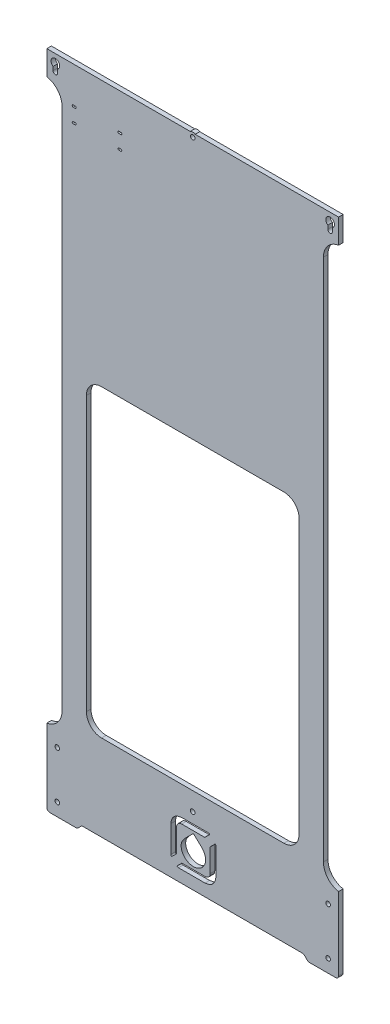
from build123d import *

# Parameters (mm, degrees)
SKETCH1_R           = 1.5
BOSS_EXTRUDE1_DEPTH = 3
SKETCH2_W           = 10
SKETCH2_H           = 368
CUT_EXTRUDE1_DEPTH  = 407.004798494
FILLET1_R           = 12
SKETCH3_R           = 1.5
CUT_EXTRUDE2_DEPTH  = 407.004798494
SKETCH4_W           = 139.84
SKETCH4_H           = 200
CUT_EXTRUDE3_DEPTH  = 407.004798494
FILLET2_R           = 10
CUT_EXTRUDE6_DEPTH  = 407.004798494
BOSS_EXTRUDE2_DEPTH = 3
CUT_EXTRUDE7_DEPTH  = 407.490647492
FILLET3_R           = 2


with BuildPart() as part:
    # Sketch1 → Boss-Extrude1 (new body)
    with BuildSketch(Plane.XY):
        Polygon((95.92, 394.5), (-95.92, 394.5), (-95.92, -36.5), (-95.92, -39.5), (-75.92, -39.5), (-72.92, -36.5), (72.92, -36.5), (75.92, -39.5), (95.92, -39.5), (95.92, -36.5), align=None)
        with Locations((89.02, -31)):
            Circle(SKETCH1_R, mode=Mode.SUBTRACT)
        with BuildLine():
            Line((-91.82, 384), (-91.82, 386.423324163))
            ThreePointArc((-91.82, 386.423324163), (-90.32, 391.696648326), (-88.82, 386.423324163))
            Line((-88.82, 386.423324163), (-88.82, 384))
            ThreePointArc((-88.82, 384), (-90.32, 382.5), (-91.82, 384))
        make_face(mode=Mode.SUBTRACT)
        with BuildLine():
            Line((88.82, 384), (88.82, 386.423324163))
            ThreePointArc((88.82, 386.423324163), (90.32, 391.696648326), (91.82, 386.423324163))
            Line((91.82, 386.423324163), (91.82, 384))
            ThreePointArc((91.82, 384), (90.32, 382.5), (88.82, 384))
        make_face(mode=Mode.SUBTRACT)
        with BuildLine():
            ThreePointArc((-90.52, 0), (-89.02, -1.5), (-87.52, 0))
            ThreePointArc((-87.52, 0), (-89.02, 1.5), (-90.52, 0))
        make_face(mode=Mode.SUBTRACT)
        with BuildLine():
            ThreePointArc((87.52, 0), (89.02, -1.5), (90.52, 0))
            ThreePointArc((90.52, 0), (89.02, 1.5), (87.52, 0))
        make_face(mode=Mode.SUBTRACT)
        with BuildLine():
            ThreePointArc((-90.52, -31), (-89.02, -32.5), (-87.52, -31))
            ThreePointArc((-87.52, -31), (-89.02, -29.5), (-90.52, -31))
        make_face(mode=Mode.SUBTRACT)
    extrude(amount=BOSS_EXTRUDE1_DEPTH)

    # Sketch2 → Cut-Extrude1 (cut, through all)
    with BuildSketch(Plane.XY.offset(3)):
        with Locations((-90.92, 194.5)):
            Rectangle(SKETCH2_W, SKETCH2_H)
        with Locations((90.92, 194.5)):
            Rectangle(SKETCH2_W, SKETCH2_H)
    extrude(amount=-CUT_EXTRUDE1_DEPTH, mode=Mode.SUBTRACT)

    # Fillet1
    # the kernel refuses this fillet: 12 mm, written as the material it adds along each edge
    with BuildSketch(Plane(origin=(85.92, 10.5, 3), x_dir=(0, 1, 0), z_dir=(0, 0, -1))) as fillet1_piece_1:
        with BuildLine():
            CenterArc((11.832159566, 12), FILLET1_R, 189.594068227, 80.405931773)
            Line((0, 10), (-0.236643191, 9.96))
            ThreePointArc((-0.236643191, 9.96), (-0.24, 5), (-0.24, 0))
            Line((-0.24, 0), (0, -0.24))
            Line((0, -0.24), (11.832159566, -0.24))
            Line((11.832159566, -0.24), (11.832159566, 0))
        make_face()
    extrude(amount=3)
    with BuildSketch(Plane(origin=(-85.92, 10.5, 3), x_dir=(-1, 0, 0), z_dir=(0, 0, -1)), Plane(origin=(85.92, 378.5, 3), x_dir=(1, 0, 0), z_dir=(0, 0, -1))) as fillet1_piece_2:
        with BuildLine():
            CenterArc((12, 11.832159566), FILLET1_R, 180, 80.405931773)
            Line((0, 11.832159566), (-0.24, 11.832159566))
            Line((-0.24, 11.832159566), (-0.24, 0))
            Line((-0.24, 0), (0, -0.24))
            ThreePointArc((0, -0.24), (5, -0.24), (9.96, -0.236643191))
            Line((9.96, -0.236643191), (10, 0))
        make_face()
    extrude(amount=3)
    with BuildSketch(Plane(origin=(-85.92, 378.5, 3), x_dir=(-1, 0, 0), z_dir=(0, 0, -1))) as fillet1_piece_3:
        with BuildLine():
            CenterArc((12, -11.832159566), FILLET1_R, 99.594068227, 80.405931773)
            Line((0, -11.832159566), (-0.24, -11.832159566))
            Line((-0.24, -11.832159566), (-0.24, 0))
            Line((-0.24, 0), (0, 0.24))
            ThreePointArc((0, 0.24), (5, 0.24), (9.96, 0.236643191))
            Line((9.96, 0.236643191), (10, 0))
        make_face()
    extrude(amount=3)

    # Sketch3 → Cut-Extrude2 (cut, through all)
    with BuildSketch(Plane.XY.offset(3)):
        with Locations((0, 8)):
            Circle(SKETCH3_R)
        with Locations((0, 392)):
            Circle(SKETCH3_R)
    extrude(amount=-CUT_EXTRUDE2_DEPTH, mode=Mode.SUBTRACT)

    # Sketch4 → Cut-Extrude3 (cut, through all)
    with BuildSketch(Plane.XY.offset(3)):
        with Locations((0, 120)):
            Rectangle(SKETCH4_W, SKETCH4_H)
    extrude(amount=-CUT_EXTRUDE3_DEPTH, mode=Mode.SUBTRACT)

    # Fillet2
    fillet2_edges = [part.edges().sort_by_distance(p)[0] for p in [
        (69.92, 220, 1.5),
        (69.92, 20, 1.5),
        (-69.92, 20, 1.5),
        (-69.92, 220, 1.5),
    ]]
    fillet(fillet2_edges, radius=FILLET2_R)

    # Sketch7 → Cut-Extrude6 (cut, through all)
    with BuildSketch(Plane.XY.offset(3)):
        with BuildLine():
            Line((0, -4.625747067), (-4.853446, -9.478911067))
            add(Edge.make_bspline(
                [(-4.853446, -9.478911067), (-4.857912351, -9.483081634), (-4.866656945, -9.491247116), (-4.879059302, -9.503713001), (-5.337538841, -10.010036555), (-6.230966435, -11.055373417), (-7.331192138, -12.859816706), (-7.888732766, -15.68247692), (-6.848251753, -19.219926816), (-3.87827619, -22.168921175), (0.257731389, -23.442729161), (4.556872717, -22.384536362), (7.711761661, -19.214884535), (8.721669996, -15.693361765), (8.210921716, -12.898452929), (7.297062, -11.024788806), (6.42340495, -9.982340385), (6.00149, -9.478911067)],
                knots=[0, 0, 0, 0, 0.00048905, 0.000957504, 0.001406767, 0.055150507, 0.111017642, 0.168412939, 0.28062072, 0.389776696, 0.490762396, 0.614386559, 0.723193993, 0.835330316, 0.891393178, 0.947550538, 1, 1, 1, 1], degree=3))
            Line((6.00149, -9.478911067), (0.85164, -4.625747067))
            add(Edge.make_bspline(
                [(0.85164, -4.625747067), (0.812504777, -4.591871198), (0.735157355, -4.524918441), (0.595429053, -4.455653648), (0.494352228, -4.445831945), (0.443865, -4.440926067)],
                knots=[0, 0, 0, 0, 0.338885039, 0.6697773, 1, 1, 1, 1], degree=3))
            add(Edge.make_bspline(
                [(0.443865, -4.440926067), (0.391231255, -4.446012435), (0.28283653, -4.456487378), (0.128603807, -4.520285983), (0.042643095, -4.590777752), (0, -4.625747067)],
                knots=[0, 0, 0, 0, 0.322338023, 0.663827768, 1, 1, 1, 1], degree=3))
        make_face()
        with BuildLine():
            Line((-7.262249, -2.659011067), (7.816498, -2.659011067))
            add(Edge.make_bspline(
                [(7.816498, -2.659011067), (7.838633855, -2.657336087), (7.882028547, -2.65405249), (7.947196989, -2.646372498), (7.996383548, -2.620362599), (8.032363529, -2.594906582), (8.055666343, -2.571516128), (8.069966408, -2.556399534), (8.076952, -2.549015067)],
                knots=[0, 0, 0, 0, 0.227492727, 0.445972237, 0.663373124, 0.787115425, 0.896005733, 1, 1, 1, 1], degree=3))
            Line((8.076952, -2.549015067), (11.003915, 0.378054933))
            add(Edge.make_bspline(
                [(11.003915, 0.378054933), (11.032885577, 0.41734366), (11.090893613, 0.496011818), (11.114913005, 0.644204092), (11.087674239, 0.780129011), (11.020364912, 0.889633627), (10.92990422, 0.968536053), (10.796928563, 1.01792021), (10.636792988, 1.050210977), (10.451685735, 1.083522236), (10.32133885, 1.080968327), (10.250022702, 1.082486552), (10.237655163, 1.083110917), (10.229422255, 1.08252663), (10.225298, 1.082233933)],
                knots=[0, 0, 0, 0, 0.104345134, 0.208931166, 0.313565445, 0.39799532, 0.482811187, 0.567894079, 0.701186565, 0.836715425, 0.973246641, 0.982162759, 0.991064478, 1, 1, 1, 1], degree=3))
            Line((10.225298, 1.082233933), (-7.262249, 1.082233933))
            add(Edge.make_bspline(
                [(-7.262249, 1.082233933), (-8.511129945, 0.882704137), (-10.977178654, 0.488711261), (-13.817730251, -2.351779173), (-14.21170736, -4.818130973), (-14.411251, -6.067302067)],
                knots=[0, 0, 0, 0, 0.336153842, 0.663771636, 1, 1, 1, 1], degree=3))
            Line((-14.411251, -6.067302067), (-14.40984, -23.554462067))
            add(Edge.make_bspline(
                [(-14.40984, -23.554462067), (-14.410134083, -23.558443624), (-14.410714991, -23.566308487), (-14.410090067, -23.578170033), (-14.408523372, -23.649375149), (-14.411561941, -23.779959256), (-14.377772815, -23.965453953), (-14.347980077, -24.12632377), (-14.296470565, -24.258389655), (-14.217812969, -24.34867487), (-14.108625863, -24.416680752), (-13.972384561, -24.443941052), (-13.823855183, -24.419605944), (-13.745068287, -24.360891738), (-13.705662, -24.331525067)],
                knots=[0, 0, 0, 0, 0.008621864, 0.017030969, 0.025643238, 0.162638148, 0.298245388, 0.431901383, 0.516391776, 0.601007159, 0.685956809, 0.790142009, 0.895036806, 1, 1, 1, 1], degree=3))
            Line((-13.705662, -24.331525067), (-10.780079, -21.404598067))
            add(Edge.make_bspline(
                [(-10.780079, -21.404598067), (-10.771134268, -21.395334769), (-10.753581449, -21.37715681), (-10.726383877, -21.35014834), (-10.697695505, -21.314597849), (-10.677763559, -21.265504338), (-10.668178972, -21.20624608), (-10.668456591, -21.166390577), (-10.668601, -21.145659067)],
                knots=[0, 0, 0, 0, 0.131285455, 0.257629811, 0.390972346, 0.594165008, 0.788898108, 1, 1, 1, 1], degree=3))
            Line((-10.668601, -21.145659067), (-10.670012, -6.067302067))
            add(Edge.make_bspline(
                [(-10.670012, -6.067302067), (-10.581781089, -5.463366518), (-10.409341504, -4.283027408), (-9.04735205, -2.919969892), (-7.866579128, -2.747356264), (-7.262249, -2.659011067)],
                knots=[0, 0, 0, 0, 0.338409749, 0.6613922, 1, 1, 1, 1], degree=3))
        make_face()
        with BuildLine():
            Line((8.113889, -24.854096067), (-6.964468, -24.854096067))
            add(Edge.make_bspline(
                [(-6.964468, -24.854096067), (-6.983590791, -24.854827266), (-7.018737512, -24.856171173), (-7.072701098, -24.864605808), (-7.117000908, -24.884951669), (-7.156983989, -24.908696277), (-7.191465987, -24.934712687), (-7.213446707, -24.954986905), (-7.224925, -24.965574067)],
                knots=[0, 0, 0, 0, 0.196745559, 0.361608386, 0.557261599, 0.692766378, 0.839563136, 1, 1, 1, 1], degree=3))
            Line((-7.224925, -24.965574067), (-10.151886, -27.892526067))
            add(Edge.make_bspline(
                [(-10.151886, -27.892526067), (-10.180857353, -27.931834355), (-10.238850218, -28.010518985), (-10.262873283, -28.158684703), (-10.235694975, -28.294671316), (-10.168067382, -28.404104287), (-10.077659309, -28.482764753), (-9.945170887, -28.532717312), (-9.785065659, -28.56526856), (-9.600012365, -28.595539208), (-9.469461937, -28.601040572), (-9.398125359, -28.595822725), (-9.385664446, -28.596455901), (-9.377399042, -28.596623408), (-9.373271, -28.596707067)],
                knots=[0, 0, 0, 0, 0.104384754, 0.208950226, 0.313569176, 0.398093487, 0.483012464, 0.567612364, 0.700915154, 0.836484685, 0.973043492, 0.982112009, 0.991066088, 1, 1, 1, 1], degree=3))
            Line((-9.373271, -28.596707067), (8.113889, -28.596707067))
            add(Edge.make_bspline(
                [(8.113889, -28.596707067), (9.362902175, -28.39705422), (11.829318782, -28.002801294), (14.670409601, -25.161989582), (15.063970595, -22.695209824), (15.263284, -21.445944067)],
                knots=[0, 0, 0, 0, 0.336156644, 0.663805911, 1, 1, 1, 1], degree=3))
            Line((15.263284, -21.445944067), (15.261873, -3.960126067))
            add(Edge.make_bspline(
                [(15.261873, -3.960126067), (15.262165177, -3.95599181), (15.262750829, -3.947704952), (15.262123109, -3.935208369), (15.260639017, -3.863775454), (15.263180797, -3.73335511), (15.22980304, -3.548307751), (15.197969823, -3.388236673), (15.147963188, -3.255735572), (15.069373744, -3.16531901), (14.9599372, -3.097720575), (14.823912263, -3.070525492), (14.675444117, -3.094870647), (14.59696034, -3.153556576), (14.557691, -3.182920067)],
                knots=[0, 0, 0, 0, 0.008953482, 0.017946692, 0.027021307, 0.163490993, 0.298949058, 0.432165007, 0.516776033, 0.601601228, 0.686034701, 0.790672378, 0.895262972, 1, 1, 1, 1], degree=3))
            Line((14.557691, -3.182920067), (11.630765, -6.109884067))
            add(Edge.make_bspline(
                [(11.630765, -6.109884067), (11.621175557, -6.119082486), (11.602298416, -6.137189883), (11.573733515, -6.164993184), (11.543286048, -6.198235311), (11.526487636, -6.247686268), (11.521866647, -6.306249856), (11.521079531, -6.34710059), (11.520661, -6.368822067)],
                knots=[0, 0, 0, 0, 0.134581529, 0.264928249, 0.404990742, 0.58604785, 0.779890073, 1, 1, 1, 1], degree=3))
            Line((11.520661, -6.368822067), (11.52179, -21.445944067))
            add(Edge.make_bspline(
                [(11.52179, -21.445944067), (11.433856663, -22.050036898), (11.262002012, -23.230660386), (9.899167348, -24.593357882), (8.718300064, -24.765822413), (8.113889, -24.854096067)],
                knots=[0, 0, 0, 0, 0.33840601, 0.661371999, 1, 1, 1, 1], degree=3))
        make_face()
    extrude(amount=-CUT_EXTRUDE6_DEPTH, mode=Mode.SUBTRACT)

    # Sketch8 → Boss-Extrude2 (add)
    with BuildSketch(Plane.XY.offset(3)):
        with BuildLine():
            Line((-1.658312395, 394.5), (1.658312395, 394.5))
            ThreePointArc((1.658312395, 394.5), (0, 395), (-1.658312395, 394.5))
        make_face()
    extrude(amount=-BOSS_EXTRUDE2_DEPTH)

    # Sketch9 → Cut-Extrude7 (cut, through all)
    with BuildSketch(Plane.XY.offset(3)):
        with BuildLine():
            Line((-78.57, 371.15), (-77.27, 371.15))
            ThreePointArc((-77.27, 371.15), (-76.62, 370.5), (-77.27, 369.85))
            Line((-77.27, 369.85), (-78.57, 369.85))
            ThreePointArc((-78.57, 369.85), (-79.22, 370.5), (-78.57, 371.15))
        make_face()
        with BuildLine():
            Line((-78.57, 361.65), (-77.27, 361.65))
            ThreePointArc((-77.27, 361.65), (-76.62, 361), (-77.27, 360.35))
            Line((-77.27, 360.35), (-78.57, 360.35))
            ThreePointArc((-78.57, 360.35), (-79.22, 361), (-78.57, 361.65))
        make_face()
        with BuildLine():
            Line((-48.57, 371.15), (-47.27, 371.15))
            ThreePointArc((-47.27, 371.15), (-46.62, 370.5), (-47.27, 369.85))
            Line((-47.27, 369.85), (-48.57, 369.85))
            ThreePointArc((-48.57, 369.85), (-49.22, 370.5), (-48.57, 371.15))
        make_face()
        with BuildLine():
            Line((-48.57, 361.65), (-47.27, 361.65))
            ThreePointArc((-47.27, 361.65), (-46.62, 361), (-47.27, 360.35))
            Line((-47.27, 360.35), (-48.57, 360.35))
            ThreePointArc((-48.57, 360.35), (-49.22, 361), (-48.57, 361.65))
        make_face()
    extrude(amount=-CUT_EXTRUDE7_DEPTH, mode=Mode.SUBTRACT)

    # Fillet3
    fillet3_edges = [part.edges().sort_by_distance(p)[0] for p in [
        (95.92, -39.5, 1.5),
        (75.92, -39.5, 1.5),
        (72.92, -36.5, 1.5),
        (-72.92, -36.5, 1.5),
        (-75.92, -39.5, 1.5),
        (-95.92, -39.5, 1.5),
    ]]
    fillet(fillet3_edges, radius=FILLET3_R)


solid = part.part
